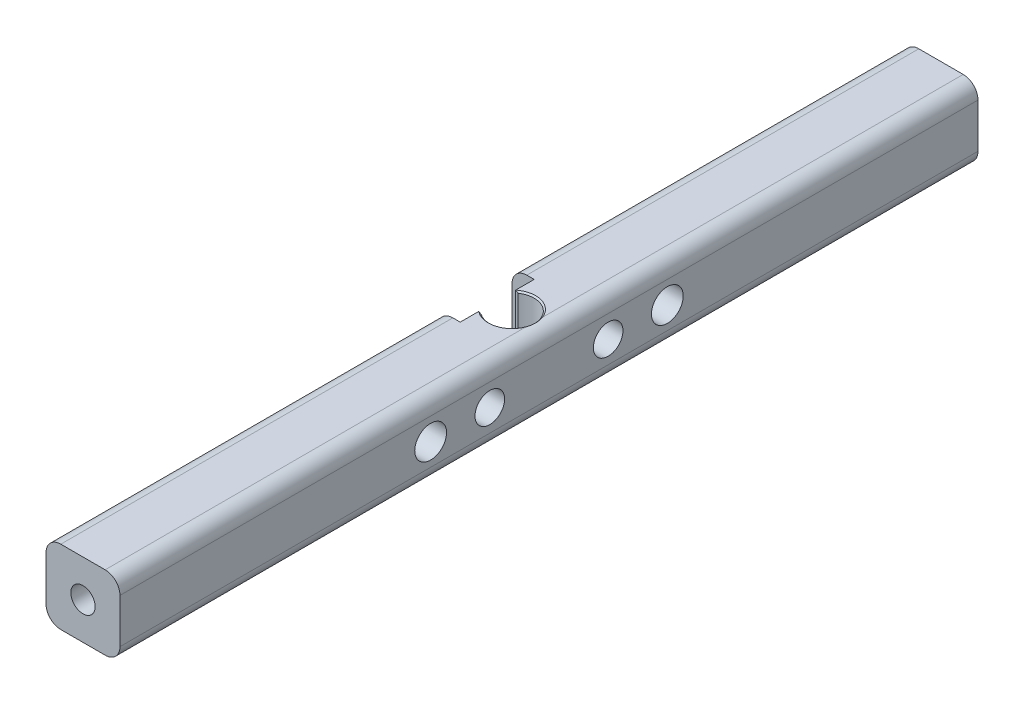
from build123d import *

# Parameters (mm, degrees)
ESQUISSE1_W                                        = 10
ESQUISSE1_H                                        = 10
BOSS_EXTRU_1_DEPTH                                 = 58
ENL_V_MAT_EXTRU_2_REACH                            = 61.068
ESQUISSE12_R                                       = 3
CHANFREIN1_SIZE                                    = 0.2
CONG_1_R                                           = 2
TROU_TARAUD_M41_D                                  = 3.3
TROU_TARAUD_M41_DEPTH                              = 11.5
TROU_TARAUD_M41_TIP                                = 0.991420021
TROU_TARAUD_M42_D                                  = 3.3
TROU_TARAUD_M42_DEPTH                              = 11.5
TROU_TARAUD_M42_TIP                                = 0.991420021
DIAM_TRE_DU_PER_AGE_4_0_4_1_D                      = 4
DIAM_TRE_DU_PER_AGE_4_0_4_1_DEPTH                  = 5
DIAM_TRE_DU_PER_AGE_4_0_4_1_TIP                    = 1.201721238
CHAMBRAGE_POUR_VIS_T_TE_HEXAGONALE_M41_D           = 4.3
CHAMBRAGE_POUR_VIS_T_TE_HEXAGONALE_M41_CBORE_D     = 8
CHAMBRAGE_POUR_VIS_T_TE_HEXAGONALE_M41_CBORE_DEPTH = 4.4
TROU_TARAUD_M31_D                                  = 2.5
TROU_TARAUD_M31_DEPTH                              = 8.5
TROU_TARAUD_M31_TIP                                = 0.751075774
ESQUISSE25_W                                       = 10
ESQUISSE25_H                                       = 20
ENL_V_MAT_EXTRU_4_DEPTH                            = 3
CASSER_START                                       = -10
ESQUISSE26_W                                       = 5
ESQUISSE26_H                                       = 5
CASSER_ANGLE_DEPTH                                 = 10


with BuildPart() as part:
    # Esquisse1 → Boss.-Extru.1 (new, symmetric)
    with BuildSketch(Plane.XY):
        Rectangle(ESQUISSE1_W, ESQUISSE1_H)
    extrude(amount=BOSS_EXTRU_1_DEPTH, both=True)

    # Esquisse12 → Enlèv. mat.-Extru.2 (cut, up to next)
    with BuildSketch(Plane(origin=(0, 5, 0), x_dir=(1, 0, 0), z_dir=(0, 1, 0)), mode=Mode.PRIVATE) as enl_v_mat_extru_2_sk1:
        with Locations(Location((0, 0, 0), (0, 0, 180))):
            Circle(ESQUISSE12_R)
    enl_v_mat_extru_2_tool1 = extrude(enl_v_mat_extru_2_sk1.sketch, amount=-ENL_V_MAT_EXTRU_2_REACH, mode=Mode.PRIVATE) & part.part
    add(enl_v_mat_extru_2_tool1.solids().sort_by_distance((0, 5, 0))[0], mode=Mode.SUBTRACT)

    # Chanfrein1
    chanfrein1_edges = [part.edges().sort_by_distance(p)[0] for p in [
        (3, 5, 0),
        (3, -5, 0),
    ]]
    chamfer(chanfrein1_edges, length=CHANFREIN1_SIZE)

    # Congé1
    # the kernel refuses this fillet: 2 mm, written as the material it takes off along each edge
    with BuildSketch(Plane(origin=(-5, 5, -63), x_dir=(1, 0, 0), z_dir=(0, 0, 1)), Plane(origin=(5, 5, 63), x_dir=(-1, 0, 0), z_dir=(0, 0, -1)), Plane(origin=(5, -5, 63), x_dir=(0, 1, 0), z_dir=(0, 0, -1)), Plane(origin=(-5, -5, -63), x_dir=(0, 1, 0), z_dir=(0, 0, 1))) as cong_1_piece_1:
        with BuildLine():
            CenterArc((CONG_1_R, -CONG_1_R), CONG_1_R, 90, 90)
            Line((0, -CONG_1_R), (0, 0))
            Line((0, 0), (CONG_1_R, 0))
        make_face()
    extrude(amount=126, mode=Mode.SUBTRACT)

    # Trou taraudé M41
    with Locations(Plane.XY.offset(58)):
        with Locations((0, 0)):
            Hole(TROU_TARAUD_M41_D / 2, depth=TROU_TARAUD_M41_DEPTH)
            with Locations((0, 0, -(TROU_TARAUD_M41_DEPTH + TROU_TARAUD_M41_TIP / 2))):  # 118° drill point
                Cone(0, TROU_TARAUD_M41_D / 2, TROU_TARAUD_M41_TIP, mode=Mode.SUBTRACT)

    # Trou taraudé M42
    with Locations(Plane(origin=(0, 0, -58), x_dir=(-1, 0, 0), z_dir=(0, 0, -1))):
        with Locations((0, 0)):
            Hole(TROU_TARAUD_M42_D / 2, depth=TROU_TARAUD_M42_DEPTH)
            with Locations((0, 0, -(TROU_TARAUD_M42_DEPTH + TROU_TARAUD_M42_TIP / 2))):  # 118° drill point
                Cone(0, TROU_TARAUD_M42_D / 2, TROU_TARAUD_M42_TIP, mode=Mode.SUBTRACT)

    # Diamètre du perçage Ø4.0 (4)1
    with Locations(Plane(origin=(5, 0, 0), x_dir=(0, 0, -1), z_dir=(1, 0, 0))):
        with Locations((8, 0), (-8, 0)):
            Hole(DIAM_TRE_DU_PER_AGE_4_0_4_1_D / 2, depth=DIAM_TRE_DU_PER_AGE_4_0_4_1_DEPTH)
            with Locations((0, 0, -(DIAM_TRE_DU_PER_AGE_4_0_4_1_DEPTH + DIAM_TRE_DU_PER_AGE_4_0_4_1_TIP / 2))):  # 118° drill point
                Cone(0, DIAM_TRE_DU_PER_AGE_4_0_4_1_D / 2, DIAM_TRE_DU_PER_AGE_4_0_4_1_TIP, mode=Mode.SUBTRACT)

    # Chambrage pour vis à tête hexagonale M41 (through all)
    with Locations(Plane.ZY.offset(5)):
        with Locations((-16, 0), (16, 0)):
            CounterBoreHole(CHAMBRAGE_POUR_VIS_T_TE_HEXAGONALE_M41_D / 2, CHAMBRAGE_POUR_VIS_T_TE_HEXAGONALE_M41_CBORE_D / 2, CHAMBRAGE_POUR_VIS_T_TE_HEXAGONALE_M41_CBORE_DEPTH)

    # Trou taraudé M31
    with Locations(Plane.ZY.offset(5)):
        with Locations((-8, 0), (8, 0)):
            Hole(TROU_TARAUD_M31_D / 2, depth=TROU_TARAUD_M31_DEPTH)
            with Locations((0, 0, -(TROU_TARAUD_M31_DEPTH + TROU_TARAUD_M31_TIP / 2))):  # 118° drill point
                Cone(0, TROU_TARAUD_M31_D / 2, TROU_TARAUD_M31_TIP, mode=Mode.SUBTRACT)

    # Esquisse25 → Enlèv. mat.-Extru.4 (cut)
    with BuildSketch(Plane.ZY.offset(5)):
        Rectangle(ESQUISSE25_W, ESQUISSE25_H)
    extrude(amount=-ENL_V_MAT_EXTRU_4_DEPTH, mode=Mode.SUBTRACT)

    # Esquisse26 → Casser Angle (cut)
    with BuildSketch(Plane(origin=(0, 5, 0), x_dir=(1, 0, 0), z_dir=(0, 1, 0)).offset(CASSER_START)):
        with Locations((-2.5, 0)):
            Rectangle(ESQUISSE26_W, ESQUISSE26_H)
    extrude(amount=CASSER_ANGLE_DEPTH, mode=Mode.SUBTRACT)


solid = part.part
